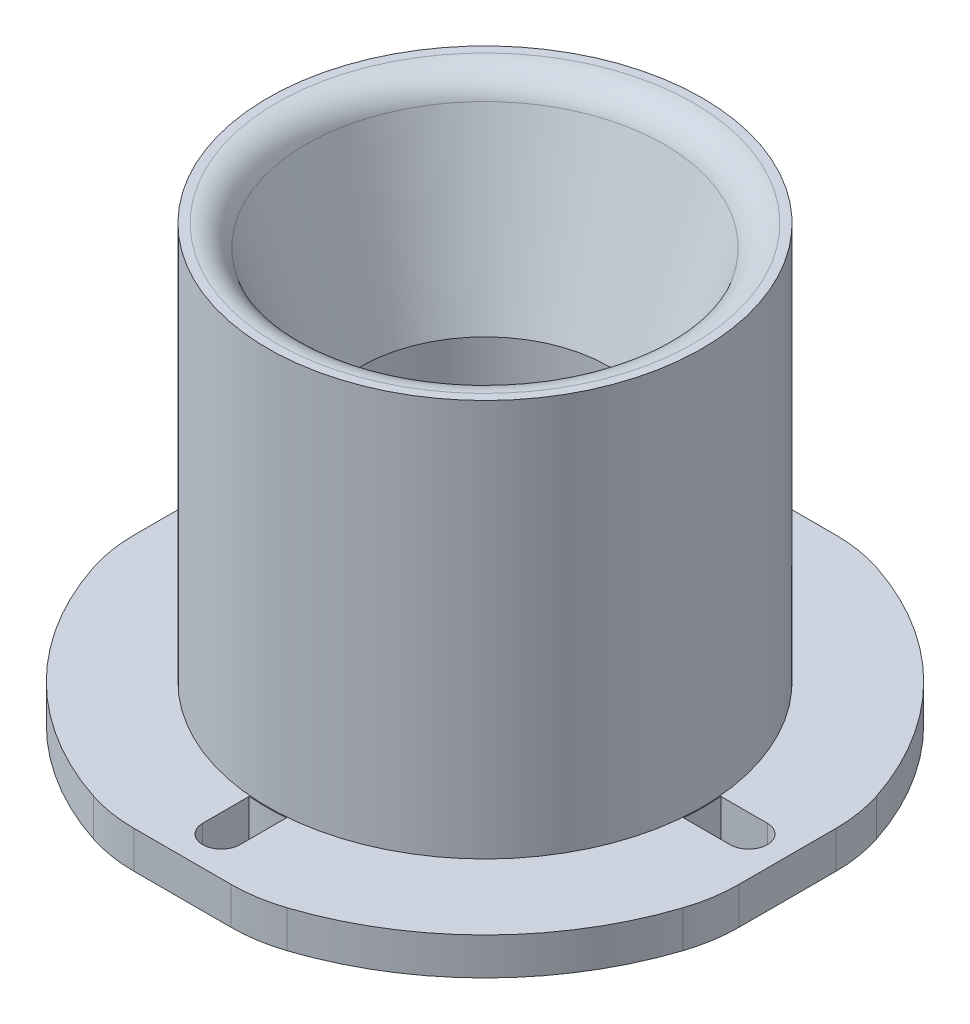
from build123d import *

# Parameters (mm, degrees)
FILLET1_R           = 2.54
BOSS_EXTRUDE1_START = -3.048
SKETCH2_R           = 25.4
SKETCH2_R_2         = 17.78
BOSS_EXTRUDE1_DEPTH = 3.048
CUT_EXTRUDE1_START  = -3.048
CUT_EXTRUDE1_DEPTH  = 3.048
SKETCH5_OUTSIDE_W   = 68.832
SKETCH5_OUTSIDE_H   = 68.832
SKETCH5_OUTSIDE_W_2 = 49.53
SKETCH5_OUTSIDE_H_2 = 49.53
CUT_EXTRUDE2_DEPTH  = 49.449459687
FILLET2_R           = 12.7


# Read off the part's stored shape, not the designer's step: Cut-Extrude1
with BuildPart() as part:
    # Sketch1 → Revolve1 (revolve)
    with BuildSketch(Plane(origin=(0, 0, 0), x_dir=(0, 0, -1), z_dir=(1, 0, 0)), mode=Mode.PRIVATE) as revolve1_sk:
        Polygon((-15.24, 0), (-10.16, -15.24), (-10.16, -35.56), (-17.78, -35.56), (-17.78, 0), align=None)
    revolve(revolve1_sk.sketch.rotate(Axis((0, -35.56, 0), (0, 1, 0)), 180), axis=Axis((0, -35.56, 0), (0, 1, 0)))

    # Fillet1
    fillet1_edges = [part.edges().sort_by_distance(p)[0] for p in [
        (0, 0, 15.24),
    ]]
    fillet(fillet1_edges, radius=FILLET1_R)

    # Sketch2 → Boss-Extrude1 (add)
    with BuildSketch(Plane.XZ.offset(35.56).offset(BOSS_EXTRUDE1_START)):
        with Locations(Location((0, 0, 0), (0, 0, 270))):
            Circle(SKETCH2_R)
        with Locations(Location((0, 0, 0), (0, 0, 270))):
            Circle(SKETCH2_R_2, mode=Mode.SUBTRACT)
    extrude(amount=BOSS_EXTRUDE1_DEPTH)

    # Cut-Extrude1 outline → Cut-Extrude1 (cut)
    with BuildSketch(Plane(origin=(0, -32.512, 0), x_dir=(1, 0, 0), z_dir=(0, 1, 0)).offset(CUT_EXTRUDE1_START)):
        with BuildLine():
            ThreePointArc((-1.524, 17.78), (0, 17.845194759), (1.524, 17.78))
            Line((1.524, 17.78), (1.524, 21.59))
            ThreePointArc((1.524, 21.59), (0, 23.114), (-1.524, 21.59))
            Line((-1.524, 21.59), (-1.524, 17.78))
        make_face()
        with BuildLine():
            ThreePointArc((-17.78, -1.524), (-17.845194759, 0), (-17.78, 1.524))
            Line((-17.78, 1.524), (-21.59, 1.524))
            ThreePointArc((-21.59, 1.524), (-23.114, 0), (-21.59, -1.524))
            Line((-21.59, -1.524), (-17.78, -1.524))
        make_face()
        with BuildLine():
            ThreePointArc((1.524, -17.78), (0, -17.845194759), (-1.524, -17.78))
            Line((-1.524, -17.78), (-1.524, -21.59))
            ThreePointArc((-1.524, -21.59), (0, -23.114), (1.524, -21.59))
            Line((1.524, -21.59), (1.524, -17.78))
        make_face()
        with BuildLine():
            ThreePointArc((17.78, 1.524), (17.845194759, 0), (17.78, -1.524))
            Line((17.78, -1.524), (21.59, -1.524))
            ThreePointArc((21.59, -1.524), (23.114, 0), (21.59, 1.524))
            Line((21.59, 1.524), (17.78, 1.524))
        make_face()
    extrude(amount=CUT_EXTRUDE1_DEPTH, mode=Mode.SUBTRACT)

    # Sketch5 outside → Cut-Extrude2 (cut, through all)
    with BuildSketch(Plane(origin=(0, -32.512, 0), x_dir=(1, 0, 0), z_dir=(0, 1, 0))):
        Rectangle(SKETCH5_OUTSIDE_W, SKETCH5_OUTSIDE_H)
        Rectangle(SKETCH5_OUTSIDE_W_2, SKETCH5_OUTSIDE_H_2, mode=Mode.SUBTRACT)
    extrude(amount=-CUT_EXTRUDE2_DEPTH, mode=Mode.SUBTRACT)

    # Fillet2
    fillet2_edges = [part.edges().sort_by_distance(p)[0] for p in [
        (24.765, -34.036, 5.644003455),
        (24.765, -34.036, -5.644003455),
        (-5.644003455, -34.036, 24.765),
        (5.644003455, -34.036, 24.765),
        (-24.765, -34.036, -5.644003455),
        (-24.765, -34.036, 5.644003455),
        (5.644003455, -34.036, -24.765),
        (-5.644003455, -34.036, -24.765),
    ]]
    fillet(fillet2_edges, radius=FILLET2_R)


solid = part.part
